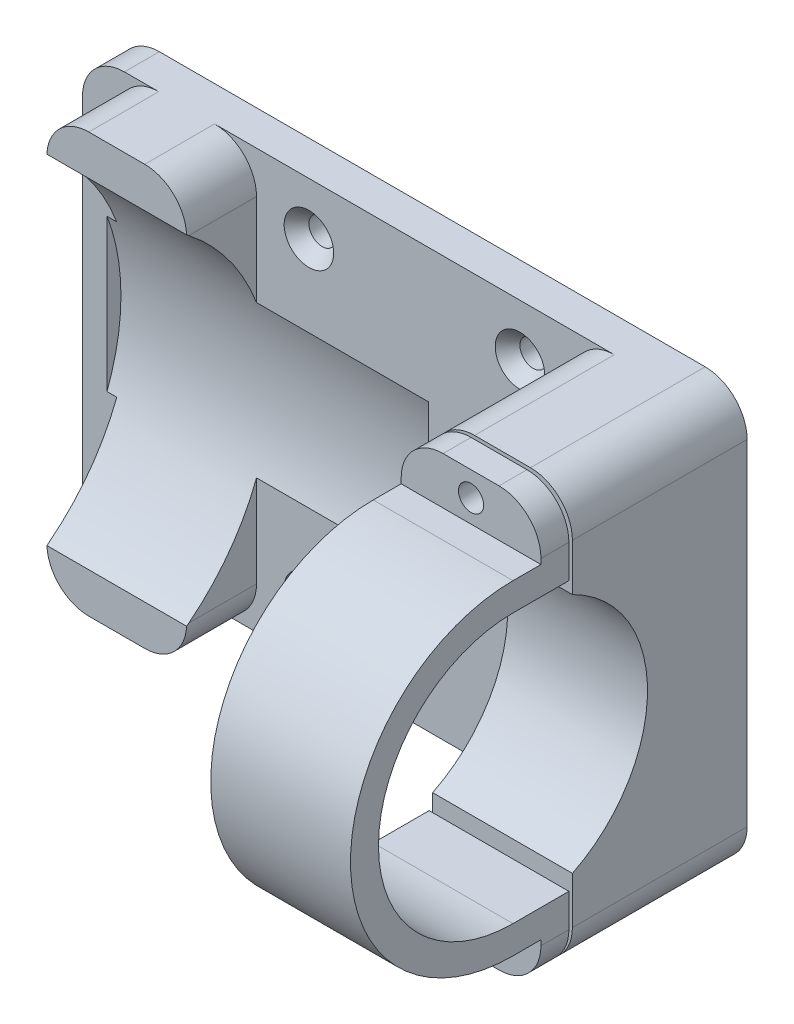
from build123d import *

# Parameters (mm, degrees)
BASE_SKETCH_W                   = 90
BASE_SKETCH_H                   = 60
BASE_EXTRUDE_DEPTH              = 5
CRADLE_SKETCH_W                 = 20
CRADLE_SKETCH_H                 = 60
CRADLE_EXTRUDE_DEPTH            = 25
NO_6_MOUNTING_HOLES_D           = 3.7973
NO_6_MOUNTING_HOLES_CSINK_D     = 7.0866
NO_6_MOUNTING_HOLES_CSINK_ANGLE = 82
MOVE_START                      = 15
MOVE_FACE_OUTLINE_W             = 20
MOVE_FACE_OUTLINE_H             = 60
MOVE_FACE_DEPTH                 = 10
CLAMP_THREADED_HOLE_D           = 2.5
CRADLE_FILLETS_R                = 6
BASE_FILLETS_R                  = 6
MOTOR_START                     = 22.6
MOTOR_CLAMP_EXTRUDE_DEPTH       = 20
SKETCH9_W                       = 1.8
SKETCH9_H                       = 4
CLAMP_CORNER_FILLETS_R          = 6


# Read off the part's stored shape, not the designer's step: Move Face
with BuildPart() as part:
    # Base Sketch → Base Extrude (new body)
    with BuildSketch(Plane.XY):
        with Locations((-2.5, 0)):
            Rectangle(BASE_SKETCH_W, BASE_SKETCH_H)
    extrude(amount=BASE_EXTRUDE_DEPTH)

    # Cradle Sketch → Cradle Extrude (add)
    with BuildSketch(Plane.XY):
        with Locations((-32.6, 0)):
            Rectangle(CRADLE_SKETCH_W, CRADLE_SKETCH_H)
        with Locations((32.6, 0)):
            Rectangle(CRADLE_SKETCH_W, CRADLE_SKETCH_H)
    extrude(amount=CRADLE_EXTRUDE_DEPTH)

    # No. 6 Mounting Holes (through all)
    with Locations(Plane.XY.offset(5)):
        with Locations((-15.1, 22.5), (15.1, 22.5), (-15.1, -22.5), (15.1, -22.5)):
            CounterSinkHole(NO_6_MOUNTING_HOLES_D / 2, NO_6_MOUNTING_HOLES_CSINK_D / 2, counter_sink_angle=NO_6_MOUNTING_HOLES_CSINK_ANGLE)

    # Pump and Motor Revolve Cut Sketch → Pump and Motor Revolve Cut (revolve, cut)
    with BuildSketch(Plane(origin=(0, 0, 0), x_dir=(1, 0, 0), z_dir=(0, 1, 0))):
        Polygon((-44, -33.5), (-44, -3), (2, -3), (2, -14.25), (66, -14.25), (66, -33.5), align=None)
    revolve(axis=Axis((66, 0, 33.5), (-1, 0, 0)), mode=Mode.SUBTRACT)

    # Move Face outline → Move Face (cut)
    with BuildSketch(Plane.XY.offset(MOVE_START)):
        with Locations((-32.6, 0)):
            Rectangle(MOVE_FACE_OUTLINE_W, MOVE_FACE_OUTLINE_H)
    extrude(amount=MOVE_FACE_DEPTH, mode=Mode.SUBTRACT)

    # Clamp Threaded Hole (through all)
    with Locations(Plane.XY.offset(25)):
        with Locations((32.6, -26.5)):
            clamp_threaded_hole = Hole(CLAMP_THREADED_HOLE_D / 2)

    # Cradle Fillets
    cradle_fillets_edges = [part.edges().sort_by_distance(p)[0] for p in [
        (-42.6, 30, 10),
        (42.6, 30, 12.5),
        (42.6, -30, 12.5),
        (-42.6, -30, 10),
        (22.6, 30, 15),
        (22.6, -30, 15),
        (-22.6, 30, 10),
        (-22.6, -30, 10),
    ]]
    fillet(cradle_fillets_edges, radius=CRADLE_FILLETS_R)

    # Base Fillets
    base_fillets_edges = [part.edges().sort_by_distance(p)[0] for p in [
        (-47.5, -30, 2.5),
        (-47.5, 30, 2.5),
    ]]
    fillet(base_fillets_edges, radius=BASE_FILLETS_R)


with BuildPart() as body_2:
    # Hold Down Bracket Sketch → Motor Clamp Extrude (new body)
    with BuildSketch(Plane(origin=(0, 0, 0), x_dir=(0, 0, -1), z_dir=(1, 0, 0)).offset(MOTOR_START)):
        with BuildLine():
            Line((-33.5, -23.25), (-29.5, -23.25))
            Line((-29.5, -23.25), (-29.5, -30))
            Line((-29.5, -30), (-25.5, -30))
            Line((-25.5, -30), (-25.5, -19.25))
            Line((-25.5, -19.25), (-33.5, -19.25))
            ThreePointArc((-33.5, -19.25), (-52.75, 0), (-33.5, 19.25))
            Line((-33.5, 19.25), (-25.5, 19.25))
            Line((-25.5, 19.25), (-25.5, 30))
            Line((-25.5, 30), (-29.5, 30))
            Line((-29.5, 30), (-29.5, 23.25))
            Line((-29.5, 23.25), (-33.5, 23.25))
            ThreePointArc((-33.5, 23.25), (-56.75, 0), (-33.5, -23.25))
        make_face()
    extrude(amount=MOTOR_CLAMP_EXTRUDE_DEPTH)

    # Sketch9 → Clamp Clearance Hole (revolve, cut)
    with BuildSketch(Plane(origin=(32.6, -26.5, 29.5), x_dir=(0, -1, 0), z_dir=(1, 0, 0))):
        with Locations((0.9, 2)):
            Rectangle(SKETCH9_W, SKETCH9_H)
    clamp_clearance_hole = revolve(axis=Axis((32.6, -26.5, 35.85), (0, 0, -1)), mode=Mode.SUBTRACT)


with BuildPart() as motor_clamp_screw_holes_mirror_tool:
    # Motor Clamp Screw Holes Mirror: Clamp Threaded Hole, Clamp Clearance Hole across plane
    add(clamp_threaded_hole.mirror(Plane.ZX))
    add(clamp_clearance_hole.mirror(Plane.ZX))


with BuildPart() as part_1:
    add(part.part)

    # Motor Clamp Screw Holes Mirror: cut by motor_clamp_screw_holes_mirror_tool
    add(motor_clamp_screw_holes_mirror_tool.part, mode=Mode.SUBTRACT)


with BuildPart() as body_2_1:
    add(body_2.part)

    # Motor Clamp Screw Holes Mirror: cut by motor_clamp_screw_holes_mirror_tool
    add(motor_clamp_screw_holes_mirror_tool.part, mode=Mode.SUBTRACT)

    # Clamp Corner Fillets
    clamp_corner_fillets_edges = [body_2_1.edges().sort_by_distance(p)[0] for p in [
        (22.6, -30, 27.5),
        (22.6, 30, 27.5),
        (42.6, -30, 27.5),
        (42.6, 30, 27.5),
    ]]
    fillet(clamp_corner_fillets_edges, radius=CLAMP_CORNER_FILLETS_R)


solid = Compound([part_1.part, body_2_1.part])
